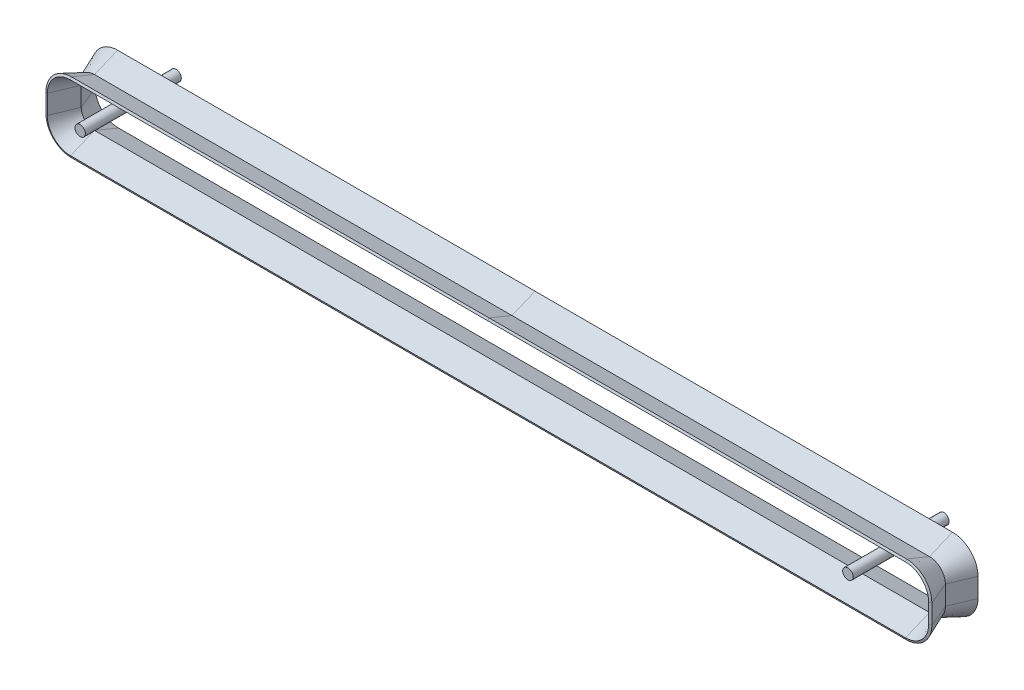
from build123d import *

# Parameters (mm, degrees)
CROQUIS61_R               = 10.861013232
SALIENTE_EXTRUIR2_DEPTH   = 100
SALIENTE_EXTRUIR2_2_DEPTH = 100


with BuildPart() as part:
    # Barrer8: sweep along a path in Croquis59
    with BuildLine(Plane.XY) as barrer8_path:
        Line((-870, 2.292783659), (870, 2.292783659))
        ThreePointArc((870, 2.292783659), (891.213203436, -6.494012905), (900, -27.707216341))
        Line((900, -27.707216341), (900, -67.707216341))
        ThreePointArc((900, -67.707216341), (891.213203436, -88.920419776), (870, -97.707216341))
        Line((870, -97.707216341), (-870, -97.707216341))
        ThreePointArc((-870, -97.707216341), (-891.213203436, -88.920419776), (-900, -67.707216341))
        Line((-900, -67.707216341), (-900, -27.707216341))
        ThreePointArc((-900, -27.707216341), (-891.213203436, -6.494012905), (-870, 2.292783659))
    # Croquis58 → Barrer8 (sweep)
    with BuildSketch(Plane(origin=(0, 0, 0), x_dir=(0, 0, -1), z_dir=(1, 0, 0))):
        Polygon((0, 0), (-50, 20.710678119), (-48.086582838, 25.330075781), (0, 5.411961001), (48.086582838, 25.330075781), (50, 20.710678119), align=None)
    sweep(path=barrer8_path.line)


with BuildPart() as body_2:
    # Croquis61 → Saliente-Extruir2 (new, symmetric)
    with BuildSketch(Plane.XY):
        with Locations((-800, -10.861013232)):
            Circle(CROQUIS61_R)
    extrude(amount=SALIENTE_EXTRUIR2_DEPTH, both=True)


with BuildPart() as body_3:
    # Croquis61 → Saliente-Extruir2 2 (new, symmetric)
    with BuildSketch(Plane.XY):
        with Locations((800, -10.861013232)):
            Circle(CROQUIS61_R)
    extrude(amount=SALIENTE_EXTRUIR2_2_DEPTH, both=True)


solid = Compound([part.part, body_2.part, body_3.part])
